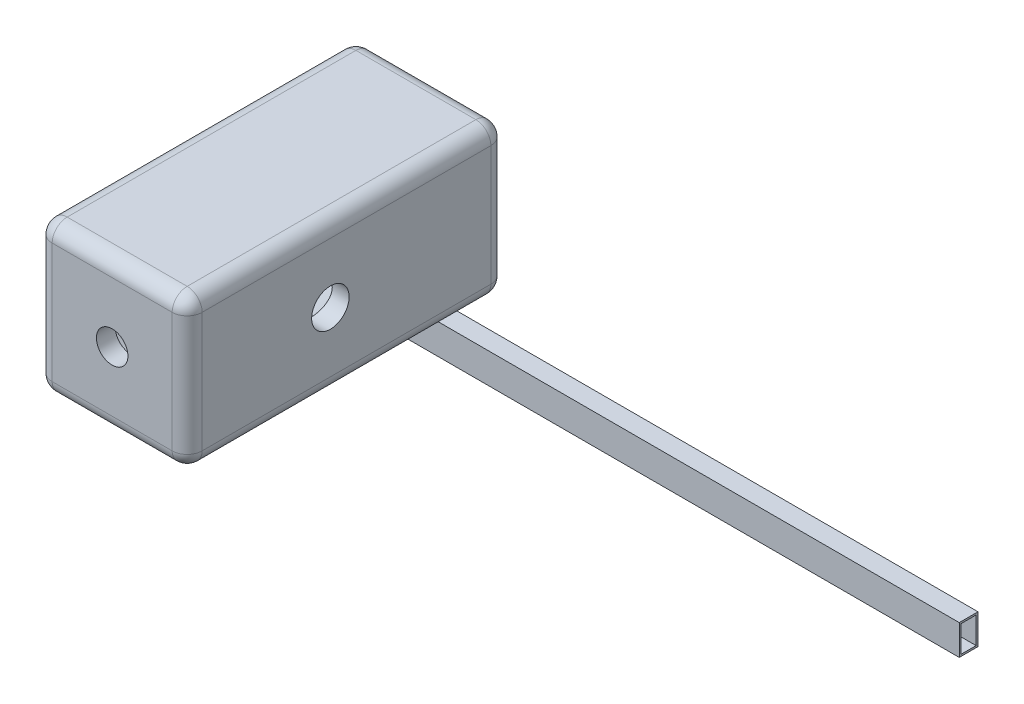
from build123d import *

# Parameters (mm, degrees)
SKETCH1_W               = 50.8
SKETCH1_H               = 50.8
BOSS_EXTRUDE1_DEPTH     = 101.6
SKETCH3_R               = 19.685
CUT_EXTRUDE1_DEPTH      = 88.9
BOSS_EXTRUDE2_DEPTH     = 10.16
SKETCH11_R              = 6.35
CUT_EXTRUDE3_DEPTH      = 20.32
SKETCH13_W              = 50.8
SKETCH13_H              = 50.8
SKETCH13_R              = 5.334
BOSS_EXTRUDE4_DEPTH     = 6.35
FILLET2_R               = 5.08
FILLET5_R               = 2.54
CUT_EXTRUDE5_DEPTH      = 127.804196843
CUT_EXTRUDE5_DEPTH_BACK = 127.804196843
SKETCH14_R              = 6.35
FILLET8_R               = 5.08
FILLET10_R              = 5.08
FILLET11_R              = 5.08
FILLET12_R              = 5.08
FILLET13_R              = 5.08
SKETCH16_W              = 10.522080148
SKETCH16_H              = 5.380343577
CUT_EXTRUDE6_DEPTH      = 33.02
SKETCH23_W              = 15.24
SKETCH23_H              = 10.12633605
BOSS_EXTRUDE8_DEPTH     = 3.81
FILLET18_R              = 2.54
FILLET19_R              = 2.54
SKETCH24_W              = 15.24
SKETCH24_H              = 10.250014382
BOSS_EXTRUDE9_DEPTH     = 25.4
SKETCH25_W              = 10.33413659
SKETCH25_H              = 6.58364474
CUT_EXTRUDE9_DEPTH      = 33.02
SKETCH26_W              = 15.24
SKETCH26_H              = 10.250014382
BOSS_EXTRUDE10_DEPTH    = 6.35
SKETCH27_W              = 6.35
SKETCH27_H              = 10.22652942
SKETCH27_W_2            = 5.084647905
SKETCH27_H_2            = 8.990346269
BOSS_EXTRUDE11_DEPTH    = 191.262
SKETCH28_W              = 5.084647905
SKETCH28_H              = 8.990346269
CUT_EXTRUDE10_DEPTH     = 6.35


with BuildPart() as part:
    # Sketch1 → Boss-Extrude1 (new body)
    with BuildSketch(Plane.XY):
        Rectangle(SKETCH1_W, SKETCH1_H)
    extrude(amount=-BOSS_EXTRUDE1_DEPTH)

    # Sketch3 → Cut-Extrude1 (cut)
    with BuildSketch(Plane.XY):
        Circle(SKETCH3_R)
    extrude(amount=-CUT_EXTRUDE1_DEPTH, mode=Mode.SUBTRACT)

    # Sketch6 → Boss-Extrude2 (add)
    with BuildSketch(Plane(origin=(0, 0, -101.6), x_dir=(-1, 0, 0), z_dir=(0, 0, -1))):
        with BuildLine():
            Line((-7.62, 0), (-7.62, -25.404790774))
            Line((-7.62, -25.404790774), (-7.62, -31.754790774))
            Line((-7.62, -31.754790774), (7.62, -31.754790774))
            Line((7.62, -31.754790774), (7.62, -25.404790774))
            Line((7.62, -25.404790774), (7.62, 0))
            ThreePointArc((7.62, 0), (0, 7.62), (-7.62, 0))
        make_face()
    extrude(amount=BOSS_EXTRUDE2_DEPTH)

    # Sketch11 → Cut-Extrude3 (cut)
    with BuildSketch(Plane.XY.offset(-88.9)):
        Circle(SKETCH11_R)
    extrude(amount=-CUT_EXTRUDE3_DEPTH, mode=Mode.SUBTRACT)

    # Sketch13 → Boss-Extrude4 (add)
    with BuildSketch(Plane.XY):
        Rectangle(SKETCH13_W, SKETCH13_H)
        Circle(SKETCH13_R, mode=Mode.SUBTRACT)
    extrude(amount=BOSS_EXTRUDE4_DEPTH)

    # Fillet2
    fillet2_edges = [part.edges().sort_by_distance(p)[0] for p in [
        (-25.4, 0, -101.6),
        (-25.4, 0, 6.35),
        (-25.4, -25.4, -47.625),
        (-25.4, 25.4, -47.625),
    ]]
    fillet(fillet2_edges, radius=FILLET2_R)

    # Fillet5
    fillet5_edges = [part.edges().sort_by_distance(p)[0] for p in [
        (0, 7.62, -111.76),
        (7.62, -15.877395387, -111.76),
        (-7.62, -15.877395387, -111.76),
    ]]
    fillet(fillet5_edges, radius=FILLET5_R)

    # Sketch14 → Cut-Extrude5 (cut, two sides: drawn at the far end of the back side and taken through both)
    with BuildSketch(Plane.ZY.offset(25.4).offset(-CUT_EXTRUDE5_DEPTH_BACK)):
        with Locations(Location((-42.164, 0, 0), (0, 0, 270))):
            Circle(SKETCH14_R)
    extrude(amount=CUT_EXTRUDE5_DEPTH + CUT_EXTRUDE5_DEPTH_BACK, mode=Mode.SUBTRACT)

    # Fillet8
    # the kernel refuses this fillet: 5.08 mm, written as the material it takes off along each edge
    with BuildSketch(Plane(origin=(-20.32, -20.32, 1.27), x_dir=(0, 0, 1), z_dir=(0, -1, 0))) as fillet8_piece_1_section:
        Polygon((0, 0), (FILLET8_R, 0), (FILLET8_R, FILLET8_R), (0, FILLET8_R), align=None)
    fillet8_piece_1 = extrude(amount=FILLET8_R, mode=Mode.PRIVATE)
    fillet8_piece_1 = fillet8_piece_1 - Plane(origin=(-20.32, -20.32, 1.27), x_dir=(0.7071067811865475, 0, -0.7071067811865475), z_dir=(0, -1, 0)) * Sphere(FILLET8_R, mode=Mode.PRIVATE)
    add(fillet8_piece_1, mode=Mode.SUBTRACT)
    with BuildSketch(Plane(origin=(-20.32, 20.32, -96.52), x_dir=(0, 1, 0), z_dir=(0, 0, -1))) as fillet8_piece_2_section:
        Polygon((0, 0), (FILLET8_R, 0), (FILLET8_R, -FILLET8_R), (0, -FILLET8_R), align=None)
    fillet8_piece_2 = extrude(amount=FILLET8_R, mode=Mode.PRIVATE)
    fillet8_piece_2 = fillet8_piece_2 - Plane(origin=(-20.32, 20.32, -96.52), x_dir=(0.7071067811865476, -0.7071067811865475, 0), z_dir=(0, 0, -1)) * Sphere(FILLET8_R, mode=Mode.PRIVATE)
    add(fillet8_piece_2, mode=Mode.SUBTRACT)
    with BuildSketch(Plane(origin=(25.4, 38.1, -101.6), x_dir=(-1, 0, 0), z_dir=(0, -1, 0))) as fillet8_piece_3:
        with BuildLine():
            CenterArc((FILLET8_R, -FILLET8_R), FILLET8_R, 90, 90)
            Line((0, -FILLET8_R), (0, 0))
            Line((0, 0), (FILLET8_R, 0))
        make_face()
    extrude(amount=76.2, mode=Mode.SUBTRACT)
    with BuildSketch(Plane(origin=(38.1, -25.4, 6.35), x_dir=(0, 0, -1), z_dir=(-1, 0, 0)), Plane(origin=(-20.32, 25.4, -101.6), x_dir=(0, -1, 0), z_dir=(1, 0, 0))) as fillet8_piece_4:
        with BuildLine():
            CenterArc((FILLET8_R, -FILLET8_R), FILLET8_R, 90, 90)
            Line((0, -FILLET8_R), (0, 0))
            Line((0, 0), (FILLET8_R, 0))
        make_face()
    extrude(amount=58.42, mode=Mode.SUBTRACT)
    with BuildSketch(Plane(origin=(25.4, -25.4, 19.05), x_dir=(-1, 0, 0), z_dir=(0, 0, -1))) as fillet8_piece_5:
        with BuildLine():
            CenterArc((FILLET8_R, FILLET8_R), FILLET8_R, 180, 90)
            Line((0, FILLET8_R), (0, 0))
            Line((0, 0), (FILLET8_R, 0))
        make_face()
    extrude(amount=133.35, mode=Mode.SUBTRACT)

    # Fillet10
    # the kernel refuses this fillet: 5.08 mm, written as the material it takes off along each edge
    with BuildSketch(Plane(origin=(20.32, -20.32, 1.27), x_dir=(0, 0, 1), z_dir=(1, 0, 0))) as fillet10_piece_1_section:
        Polygon((0, 0), (FILLET10_R, 0), (FILLET10_R, FILLET10_R), (0, FILLET10_R), align=None)
    fillet10_piece_1 = extrude(amount=FILLET10_R, mode=Mode.PRIVATE)
    fillet10_piece_1 = fillet10_piece_1 - Plane(origin=(20.32, -20.32, 1.27), x_dir=(0, 0.7071067811865475, -0.7071067811865475), z_dir=(1, 0, 0)) * Sphere(FILLET10_R, mode=Mode.PRIVATE)
    add(fillet10_piece_1, mode=Mode.SUBTRACT)
    with BuildSketch(Plane(origin=(-20.32, 20.32, 1.27), x_dir=(0, 0, 1), z_dir=(0, 1, 0))) as fillet10_piece_2_section:
        Polygon((0, 0), (FILLET10_R, 0), (FILLET10_R, -FILLET10_R), (0, -FILLET10_R), align=None)
    fillet10_piece_2 = extrude(amount=FILLET10_R, mode=Mode.PRIVATE)
    fillet10_piece_2 = fillet10_piece_2 - Plane(origin=(-20.32, 20.32, 1.27), x_dir=(0.7071067811865475, 0, -0.7071067811865475), z_dir=(0, 1, 0)) * Sphere(FILLET10_R, mode=Mode.PRIVATE)
    add(fillet10_piece_2, mode=Mode.SUBTRACT)
    with BuildSketch(Plane(origin=(-20.32, 25.4, 6.35), x_dir=(0, 0, -1), z_dir=(1, 0, 0)), Plane(origin=(25.4, 38.1, 6.35), x_dir=(0, 0, -1), z_dir=(0, -1, 0))) as fillet10_piece_3:
        with BuildLine():
            CenterArc((FILLET10_R, -FILLET10_R), FILLET10_R, 90, 90)
            Line((0, -FILLET10_R), (0, 0))
            Line((0, 0), (FILLET10_R, 0))
        make_face()
    extrude(amount=58.42, mode=Mode.SUBTRACT)

    # Fillet11
    # the kernel refuses this fillet: 5.08 mm, written as the material it takes off along each edge
    with BuildSketch(Plane(origin=(20.32, 20.32, -96.52), x_dir=(0, 1, 0), z_dir=(1, 0, 0))) as fillet11_piece_1_section:
        Polygon((0, 0), (FILLET11_R, 0), (FILLET11_R, -FILLET11_R), (0, -FILLET11_R), align=None)
    fillet11_piece_1 = extrude(amount=FILLET11_R, mode=Mode.PRIVATE)
    fillet11_piece_1 = fillet11_piece_1 - Plane(origin=(20.32, 20.32, -96.52), x_dir=(0, -0.7071067811865475, 0.7071067811865475), z_dir=(1, 0, 0)) * Sphere(FILLET11_R, mode=Mode.PRIVATE)
    add(fillet11_piece_1, mode=Mode.SUBTRACT)
    with BuildSketch(Plane(origin=(20.32, 20.32, 1.27), x_dir=(0, 1, 0), z_dir=(1, 0, 0))) as fillet11_piece_2_section:
        Polygon((0, 0), (FILLET11_R, 0), (FILLET11_R, FILLET11_R), (0, FILLET11_R), align=None)
    fillet11_piece_2 = extrude(amount=FILLET11_R, mode=Mode.PRIVATE)
    fillet11_piece_2 = fillet11_piece_2 - Plane(origin=(20.32, 20.32, 1.27), x_dir=(0, -0.7071067811865475, -0.7071067811865475), z_dir=(1, 0, 0)) * Sphere(FILLET11_R, mode=Mode.PRIVATE)
    add(fillet11_piece_2, mode=Mode.SUBTRACT)
    with BuildSketch(Plane(origin=(25.4, 25.4, 1.27), x_dir=(0, -1, 0), z_dir=(0, 0, -1))) as fillet11_piece_3:
        with BuildLine():
            CenterArc((FILLET11_R, FILLET11_R), FILLET11_R, 180, 90)
            Line((0, FILLET11_R), (0, 0))
            Line((0, 0), (FILLET11_R, 0))
        make_face()
    extrude(amount=97.79, mode=Mode.SUBTRACT)

    # Fillet12
    # the kernel refuses this fillet: 5.08 mm, written as the material it takes off along each edge
    with BuildSketch(Plane(origin=(-20.32, -20.32, -96.52), x_dir=(0, -1, 0), z_dir=(0, 0, -1))) as fillet12_piece_1_section:
        Polygon((0, 0), (FILLET12_R * 1.02, 0), (FILLET12_R * 1.02, FILLET12_R * 1.02), (0, FILLET12_R * 1.02), align=None)
    fillet12_piece_1 = extrude(amount=FILLET12_R * 1.02, mode=Mode.PRIVATE)
    fillet12_piece_1 = fillet12_piece_1 - Plane(origin=(-20.32, -20.32, -96.52), x_dir=(0.7071067811865475, 0.7071067811865477, 0), z_dir=(0, 0, -1)) * Sphere(FILLET12_R, mode=Mode.PRIVATE)
    add(fillet12_piece_1, mode=Mode.SUBTRACT)
    with BuildSketch(Plane(origin=(-7.62, -25.4, -101.6), x_dir=(0, 1, 0), z_dir=(-1, 0, 0))) as fillet12_piece_2:
        with BuildLine():
            CenterArc((FILLET12_R, -FILLET12_R), FILLET12_R, 90, 90)
            Line((0, -FILLET12_R), (0, 0))
            Line((0, 0), (FILLET12_R, 0))
        make_face()
    extrude(amount=12.7, mode=Mode.SUBTRACT)

    # Fillet13
    # the kernel refuses this fillet: 5.08 mm, written as the material it takes off along each edge
    with BuildSketch(Plane(origin=(20.32, -20.32, -96.52), x_dir=(0, -1, 0), z_dir=(0, 0, -1))) as fillet13_piece_1_section:
        Polygon((0, 0), (FILLET13_R * 1.02, 0), (FILLET13_R * 1.02, -FILLET13_R * 1.02), (0, -FILLET13_R * 1.02), align=None)
    fillet13_piece_1 = extrude(amount=FILLET13_R * 1.02, mode=Mode.PRIVATE)
    fillet13_piece_1 = fillet13_piece_1 - Plane(origin=(20.32, -20.32, -96.52), x_dir=(-0.7071067811865476, 0.7071067811865475, 0), z_dir=(0, 0, -1)) * Sphere(FILLET13_R, mode=Mode.PRIVATE)
    add(fillet13_piece_1, mode=Mode.SUBTRACT)
    with BuildSketch(Plane(origin=(20.32, -25.4, -101.6), x_dir=(0, 1, 0), z_dir=(-1, 0, 0))) as fillet13_piece_2:
        with BuildLine():
            CenterArc((FILLET13_R, -FILLET13_R), FILLET13_R, 90, 90)
            Line((0, -FILLET13_R), (0, 0))
            Line((0, 0), (FILLET13_R, 0))
        make_face()
    extrude(amount=12.7, mode=Mode.SUBTRACT)

    # Sketch16 → Cut-Extrude6 (cut)
    with BuildSketch(Plane.XZ.offset(31.754790774)):
        with Locations((0, -106.687745086)):
            Rectangle(SKETCH16_W, SKETCH16_H)
    extrude(amount=-CUT_EXTRUDE6_DEPTH, mode=Mode.SUBTRACT)

    # Sketch23 → Boss-Extrude8 (add)
    with BuildSketch(Plane.XZ.offset(31.754790774)):
        with Locations((0, -106.663168025)):
            Rectangle(SKETCH23_W, SKETCH23_H)
    extrude(amount=BOSS_EXTRUDE8_DEPTH)

    # Fillet18
    # the kernel refuses this fillet: 2.54 mm, written as the material it takes off along each edge
    with BuildSketch(Plane(origin=(7.62, -31.754790774, -111.72633605), x_dir=(-1, 0, 0), z_dir=(0, -1, 0))) as fillet18_piece_1:
        with BuildLine():
            CenterArc((FILLET18_R, -FILLET18_R), FILLET18_R, 90, 90)
            Line((0, -FILLET18_R), (0, 0))
            Line((0, 0), (FILLET18_R, 0))
        make_face()
    extrude(amount=10.16, mode=Mode.SUBTRACT)

    # Fillet19
    # the kernel refuses this fillet: 2.54 mm, written as the material it takes off along each edge
    with BuildSketch(Plane(origin=(-7.62, -31.754790774, -111.72633605), x_dir=(0, 0, 1), z_dir=(0, -1, 0))) as fillet19_piece_1:
        with BuildLine():
            CenterArc((FILLET19_R, -FILLET19_R), FILLET19_R, 90, 90)
            Line((0, -FILLET19_R), (0, 0))
            Line((0, 0), (FILLET19_R, 0))
        make_face()
    extrude(amount=10.16, mode=Mode.SUBTRACT)

    # Sketch24 → Boss-Extrude9 (add)
    with BuildSketch(Plane.XY.offset(-101.6)):
        with Locations((0, -30.525007191)):
            Rectangle(SKETCH24_W, SKETCH24_H)
    extrude(amount=BOSS_EXTRUDE9_DEPTH)

    # Sketch25 → Cut-Extrude9 (cut)
    with BuildSketch(Plane.XY.offset(-76.2)):
        with Locations((0, -30.733312974)):
            Rectangle(SKETCH25_W, SKETCH25_H)
    extrude(amount=-CUT_EXTRUDE9_DEPTH, mode=Mode.SUBTRACT)

    # Sketch26 → Boss-Extrude10 (add)
    with BuildSketch(Plane.XY.offset(-76.2)):
        with Locations((0, -30.525007191)):
            Rectangle(SKETCH26_W, SKETCH26_H)
    extrude(amount=BOSS_EXTRUDE10_DEPTH)

    # Sketch27 → Boss-Extrude11 (add)
    with BuildSketch(Plane(origin=(7.62, 0, 0), x_dir=(0, 0, -1), z_dir=(1, 0, 0))):
        with Locations((84.856460364, -30.536749672)):
            Rectangle(SKETCH27_W, SKETCH27_H)
        with Locations((84.856460365, -30.536749672)):
            Rectangle(SKETCH27_W_2, SKETCH27_H_2, mode=Mode.SUBTRACT)
    extrude(amount=BOSS_EXTRUDE11_DEPTH)

    # Sketch28 → Cut-Extrude10 (cut)
    with BuildSketch(Plane(origin=(7.62, 0, 0), x_dir=(0, 0, -1), z_dir=(1, 0, 0))):
        with Locations((84.856460365, -30.536749672)):
            Rectangle(SKETCH28_W, SKETCH28_H)
    extrude(amount=-CUT_EXTRUDE10_DEPTH, mode=Mode.SUBTRACT)


solid = part.part
